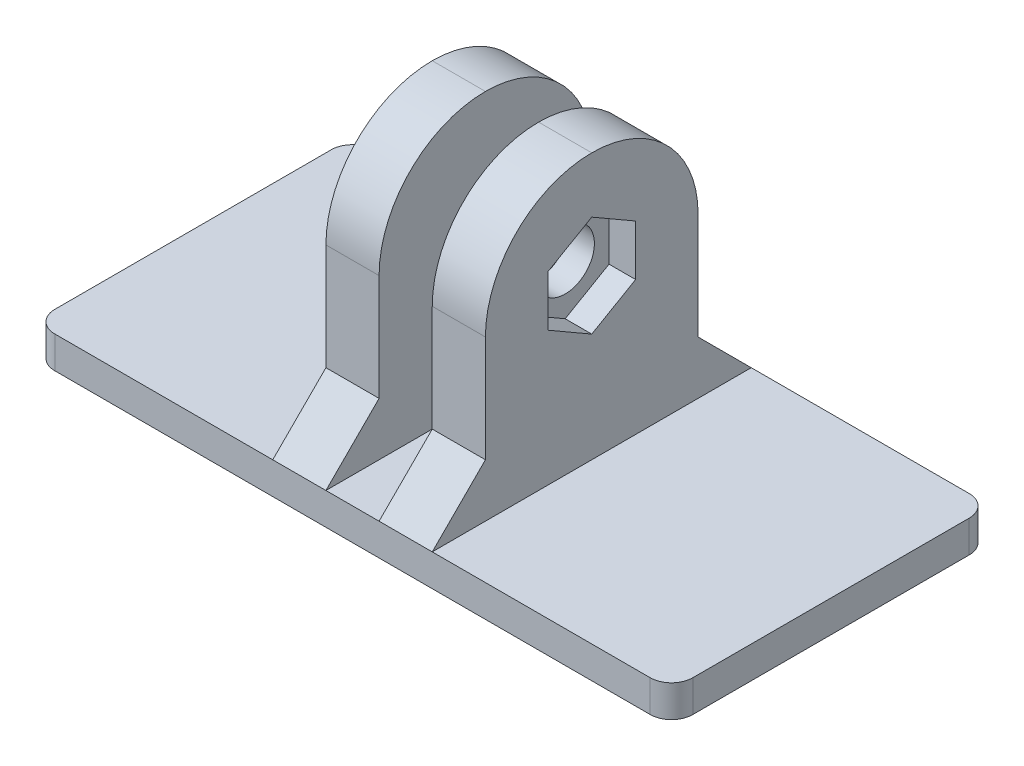
from build123d import *

# Parameters (mm, degrees)
SKETCH1_W               = 60
SKETCH1_H               = 30
BOSS_EXTRUDE1_DEPTH     = 3
FILLET2_R               = 2
SKETCH4_W               = 5
SKETCH4_H               = 20
BOSS_EXTRUDE2_DEPTH     = 25
FILLET3_R               = 10
CUT_EXTRUDE3_DEPTH      = 50.145193051
CUT_EXTRUDE3_DEPTH_BACK = 50.145193051
SKETCH5_R               = 2.75
CUT_EXTRUDE4_DEPTH      = 2.5
CHAMFER1_SIZE           = 5


with BuildPart() as part:
    # Sketch1 → Boss-Extrude1 (new body)
    with BuildSketch(Plane(origin=(0, 0, 0), x_dir=(1, 0, 0), z_dir=(0, 1, 0))):
        Rectangle(SKETCH1_W, SKETCH1_H)
    extrude(amount=BOSS_EXTRUDE1_DEPTH)

    # Fillet2
    fillet2_edges = [part.edges().sort_by_distance(p)[0] for p in [
        (-30, 1.5, -15),
        (30, 1.5, -15),
        (30, 1.5, 15),
        (-30, 1.5, 15),
    ]]
    fillet(fillet2_edges, radius=FILLET2_R)

    # Sketch4 → Boss-Extrude2 (add)
    with BuildSketch(Plane(origin=(0, 3, 0), x_dir=(1, 0, 0), z_dir=(0, 1, 0))):
        with Locations((-5, 0)):
            Rectangle(SKETCH4_W, SKETCH4_H)
        with Locations((5, 0)):
            Rectangle(SKETCH4_W, SKETCH4_H)
    extrude(amount=BOSS_EXTRUDE2_DEPTH)

    # Fillet3
    fillet3_edges = [part.edges().sort_by_distance(p)[0] for p in [
        (5, 28, 10),
        (5, 28, -10),
        (-5, 28, -10),
        (-5, 28, 10),
    ]]
    fillet(fillet3_edges, radius=FILLET3_R - 0.0001)  # a hair under: the kernel refuses the full size

    # Sketch5 → Cut-Extrude3 (cut, two sides: drawn at the far end of the back side and taken through both)
    with BuildSketch(Plane.ZY.offset(7.5).offset(-CUT_EXTRUDE3_DEPTH_BACK)):
        with Locations((0, 18)):
            Circle(SKETCH5_R)
    extrude(amount=CUT_EXTRUDE3_DEPTH + CUT_EXTRUDE3_DEPTH_BACK, mode=Mode.SUBTRACT)

    # Sketch6 → Cut-Extrude4 (cut)
    with BuildSketch(Plane(origin=(7.5, 0, 0), x_dir=(0, 0, -1), z_dir=(1, 0, 0))):
        Polygon((0, 13.236860279), (4.125, 15.61843014), (4.125, 20.38156986), (0, 22.763139721), (-4.125, 20.38156986), (-4.125, 15.61843014), align=None)
    extrude(amount=-CUT_EXTRUDE4_DEPTH, mode=Mode.SUBTRACT)

    # Chamfer1
    chamfer1_edges = [part.edges().sort_by_distance(p)[0] for p in [
        (-5, 3, -10),
        (-5, 3, 10),
        (5, 3, -10),
        (5, 3, 10),
    ]]
    chamfer(chamfer1_edges, length=CHAMFER1_SIZE - 0.0001)  # a hair under: the kernel refuses the full size


solid = part.part
